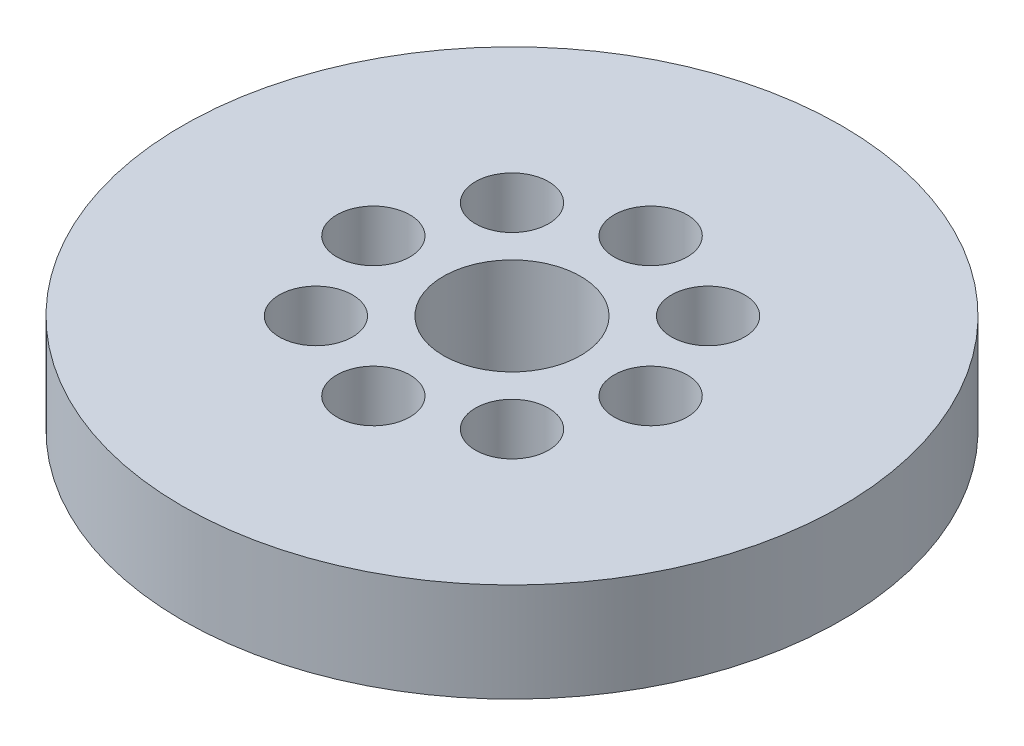
from build123d import *

# Parameters (mm, degrees)
SKETCH1_R           = 60
BOSS_EXTRUDE1_DEPTH = 18
SKETCH2_R           = 12.5
CUT_EXTRUDE1_DEPTH  = 87.740993769
SKETCH3_R           = 6.654092803
CUT_EXTRUDE2_DEPTH  = 12.480180751
CIRPATTERN1_COUNT   = 8


with BuildPart() as part:
    # Sketch1 → Boss-Extrude1 (new body)
    with BuildSketch(Plane(origin=(0, 0, 0), x_dir=(1, 0, 0), z_dir=(0, 1, 0))):
        Circle(SKETCH1_R)
    extrude(amount=BOSS_EXTRUDE1_DEPTH)

    # Sketch2 → Cut-Extrude1 (cut, through all)
    with BuildSketch(Plane(origin=(0, 0, 0), x_dir=(1, 0, 0), z_dir=(0, 1, 0))):
        Circle(SKETCH2_R)
    extrude(amount=CUT_EXTRUDE1_DEPTH, mode=Mode.SUBTRACT)

    # Sketch3 → Cut-Extrude2 (cut)
    with BuildSketch(Plane(origin=(0, 18, 0), x_dir=(1, 0, 0), z_dir=(0, 1, 0))):
        with Locations((-25.242105276, 0)):
            Circle(SKETCH3_R)
    cut_extrude2 = extrude(amount=-CUT_EXTRUDE2_DEPTH, mode=Mode.SUBTRACT)

    # CirPattern1: Cut-Extrude2 ×8 about axis
    cirpattern1_axis = Axis((0, 0, 0), (0, 1, 0))
    for i in range(1, CIRPATTERN1_COUNT):
        add(cut_extrude2.rotate(cirpattern1_axis, i * 360 / CIRPATTERN1_COUNT), mode=Mode.SUBTRACT)


solid = part.part
